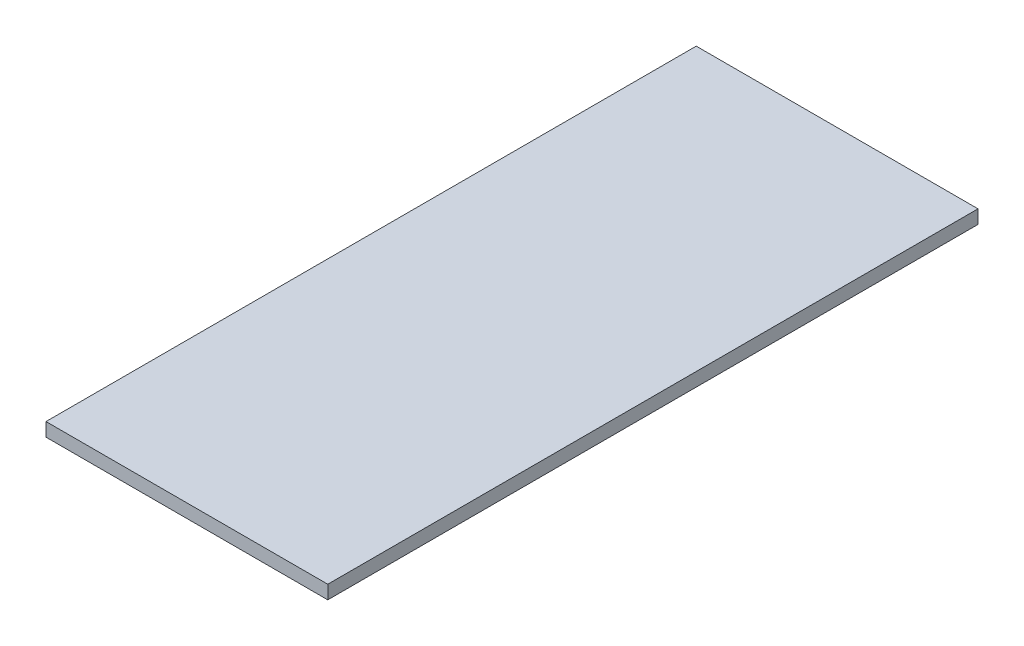
from build123d import *

# Parameters (mm, degrees)
SKETCH1_W           = 66.04
SKETCH1_H           = 152.4
BOSS_EXTRUDE1_DEPTH = 3.175


with BuildPart() as part:
    # Sketch1 → Boss-Extrude1 (new body)
    with BuildSketch(Plane(origin=(0, 0, 0), x_dir=(1, 0, 0), z_dir=(0, 1, 0))):
        with Locations((33.02, 76.2)):
            Rectangle(SKETCH1_W, SKETCH1_H)
    extrude(amount=BOSS_EXTRUDE1_DEPTH)


solid = part.part
